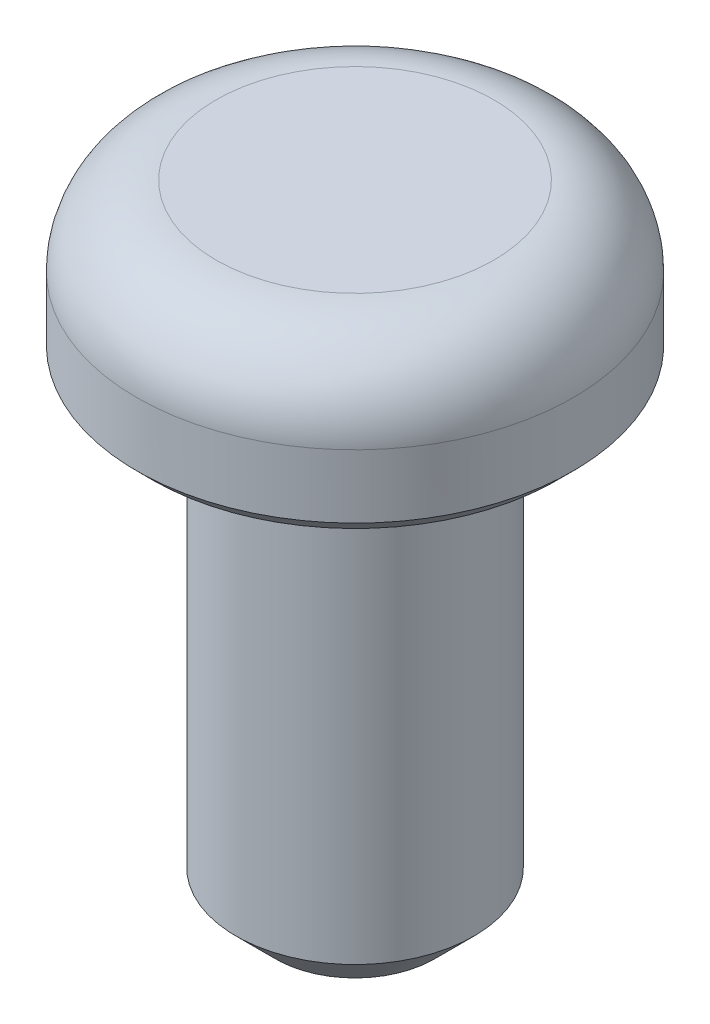
from build123d import *

# Parameters (mm, degrees)
FILLET1_R     = 1
CHAMFER1_SIZE = 0.5
CHAMFER2_SIZE = 0.2


with BuildPart() as part:
    # Sketch1 → Revolve1 (revolve)
    with BuildSketch(Plane.XY):
        Polygon((0, 0), (0, 8), (2.75, 8), (2.75, 6), (1.5, 6), (1.5, 0), align=None)
    revolve(axis=Axis((0, 0, 0), (0, 1, 0)))

    # Fillet1
    fillet1_edges = [part.edges().sort_by_distance(p)[0] for p in [
        (-2.75, 8, 0),
    ]]
    fillet(fillet1_edges, radius=FILLET1_R)

    # Chamfer1
    chamfer1_edges = [part.edges().sort_by_distance(p)[0] for p in [
        (-1.5, 0, 0),
    ]]
    chamfer(chamfer1_edges, length=CHAMFER1_SIZE)

    # Chamfer2
    chamfer2_edges = [part.edges().sort_by_distance(p)[0] for p in [
        (-2.75, 6, 0),
    ]]
    chamfer(chamfer2_edges, length=CHAMFER2_SIZE)


solid = part.part
